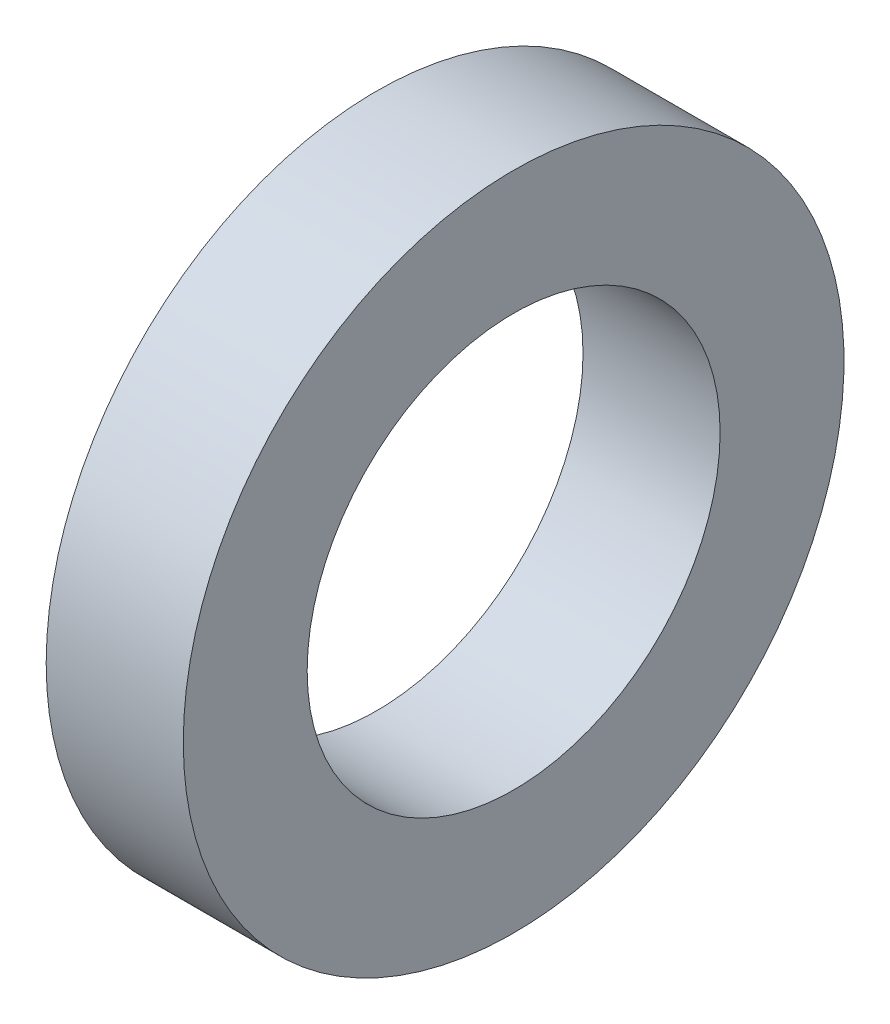
from build123d import *

# Parameters (mm, degrees)
SKETCH3_W = 4.979999946
SKETCH3_H = 4.500000017


with BuildPart() as part:
    # Sketch3 → Revolve1 (revolve)
    with BuildSketch(Plane.XY):
        with Locations((20.520400031, 9.749999995)):
            Rectangle(SKETCH3_W, SKETCH3_H)
    revolve(axis=Axis((0, 0, 0), (1, 0, 0)))


solid = part.part
